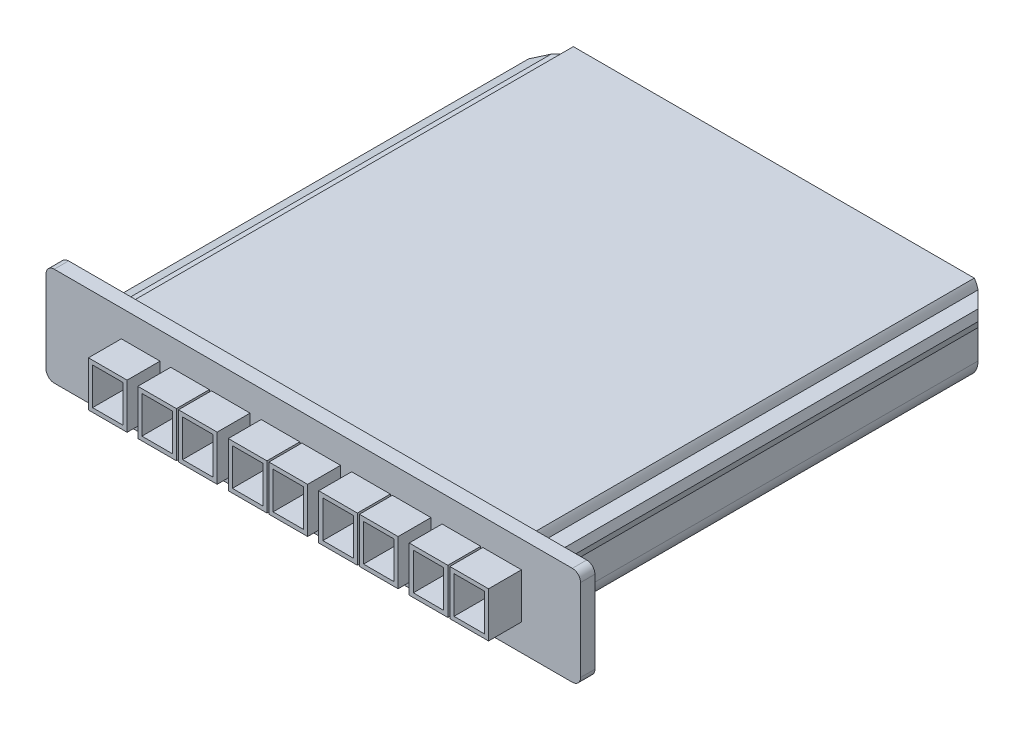
from build123d import *

# Parameters (mm, degrees)
EXTRUDE_1_DEPTH      = 12
EXTRUDE_1_DEPTH_BACK = 12
SKETCH_1_W           = 130
SKETCH_1_H           = 112
SKETCH_2_W           = 10.341275007
SKETCH_2_H           = 108.506204724
CUT_EXTRUDE_1_DEPTH  = 90.089842294
SKETCH_3_W           = 108.506204724
SKETCH_3_H           = 4.039795579
SKETCH_3_H_2         = 16.032937215
CUT_EXTRUDE_2_DEPTH  = 5
CHAMFER_1_SIZE       = 5
FILLET_1_R           = 5
CHAMFER_2_SIZE       = 2.747477419
CHAMFER_2_SIZE_2     = 1
FILLET_2_R           = 2
SKETCH_4_W           = 9.4
SKETCH_4_H           = 11
SKETCH_4_W_2         = 7.4
SKETCH_4_H_2         = 9
EXTRUDE_2_DEPTH      = 8
SKETCH_5_W           = 122.805441914
SKETCH_5_H           = 111.758877205
CUT_EXTRUDE_3_DEPTH  = 2


with BuildPart() as part:
    # 草图1 → 凸台-拉伸1 (new, two sides: drawn at the far end of the back side and taken through both)
    with BuildSketch(Plane(origin=(0, 0, 0), x_dir=(1, 0, 0), z_dir=(0, 1, 0)).offset(-EXTRUDE_1_DEPTH_BACK)):
        Rectangle(SKETCH_1_W, SKETCH_1_H)
    extrude(amount=EXTRUDE_1_DEPTH + EXTRUDE_1_DEPTH_BACK)

    # 草图2 → 切除-拉伸1 (cut, through all)
    with BuildSketch(Plane(origin=(0, 12, 0), x_dir=(1, 0, 0), z_dir=(0, 1, 0))):
        with Locations((59.829362496, 1.746897638)):
            Rectangle(SKETCH_2_W, SKETCH_2_H)
        with Locations((-59.829362496, 1.746897638)):
            Rectangle(SKETCH_2_W, SKETCH_2_H)
    extrude(amount=-CUT_EXTRUDE_1_DEPTH, mode=Mode.SUBTRACT)

    # 草图3 → 切除-拉伸2 (cut)
    with BuildSketch(Plane.ZY.offset(54.658724993)):
        with Locations((-1.746897638, 9.980102211)):
            Rectangle(SKETCH_3_W, SKETCH_3_H)
        with Locations((-1.746897638, -3.983531392)):
            Rectangle(SKETCH_3_W, SKETCH_3_H_2)
    cut_extrude_2 = extrude(amount=-CUT_EXTRUDE_2_DEPTH, mode=Mode.SUBTRACT)

    # 镜向1: 切除-拉伸2 across plane
    add(cut_extrude_2.mirror(Plane(origin=(0, 0, 0), x_dir=(0, 0, 1), z_dir=(1, 0, 0))), mode=Mode.SUBTRACT)

    # 倒角1
    chamfer_1_edges = [part.edges().sort_by_distance(p)[0] for p in [
        (-54.658724993, 5.996570818, -56),
        (54.658724993, 5.996570818, -56),
    ]]
    chamfer(chamfer_1_edges, length=CHAMFER_1_SIZE)

    # 圆角1
    # the kernel refuses this fillet: 5 mm, written as the material it takes off along each edge
    with BuildSketch(Plane(origin=(-49.658724993, 12, -68.267336577), x_dir=(0, -1, 0), z_dir=(0, 0, 1))) as fillet_1_piece_1:
        with BuildLine():
            CenterArc((5, 4.906934631), FILLET_1_R, 180, 78.928088112)
            Line((0, 4.906934631), (0, 0))
            Line((0, 0), (4.039795579, 0))
        make_face()
    extrude(amount=120.773541301, mode=Mode.SUBTRACT)
    with BuildSketch(Plane(origin=(-49.658724993, -12, -68.5), x_dir=(0, 1, 0), z_dir=(0, 0, 1)), Plane(origin=(49.658724993, -12, -68.5), x_dir=(-1, 0, 0), z_dir=(0, 0, 1))) as fillet_1_piece_2:
        with BuildLine():
            CenterArc((FILLET_1_R, -FILLET_1_R), FILLET_1_R, 90, 90)
            Line((0, -FILLET_1_R), (0, 0))
            Line((0, 0), (FILLET_1_R, 0))
        make_face()
    extrude(amount=121.006204724, mode=Mode.SUBTRACT)
    with BuildSketch(Plane(origin=(49.658724993, 12, -68.267336577), x_dir=(-1, 0, 0), z_dir=(0, 0, 1))) as fillet_1_piece_3:
        with BuildLine():
            CenterArc((4.906934631, 5), FILLET_1_R, 191.071911888, 78.928088112)
            Line((0, 4.039795579), (0, 0))
            Line((0, 0), (4.906934631, 0))
        make_face()
    extrude(amount=120.773541301, mode=Mode.SUBTRACT)

    # 倒角2
    # the kernel refuses this chamfer: 2.747477419, 1 mm, written as the material it takes off along each edge
    with BuildSketch(Plane(origin=(54.658724993, 7.960204421, 52.506204724), x_dir=(0.013184058198646324, -0.9999130865277316, 0), z_dir=(0, 0, -1))) as chamfer_2_piece_1:
        Polygon((CHAMFER_2_SIZE * 0.999913086693, CHAMFER_2_SIZE * 0.0131840582008), (-CHAMFER_2_SIZE_2 * 0.0131840581986, CHAMFER_2_SIZE_2 * 0.999913086528), (0, 0), align=None)
    extrude(amount=110.633696174, mode=Mode.SUBTRACT)
    with BuildSketch(Plane(origin=(54.658724993, 4.032937215, 52.506204724), x_dir=(-0.9950833631817486, -0.09904090225205064, 0), z_dir=(0, 0, -1))) as chamfer_2_piece_2:
        Polygon((CHAMFER_2_SIZE_2 * 0.995083363182, CHAMFER_2_SIZE_2 * 0.0990409022521), (-CHAMFER_2_SIZE * 0.0990409022684, CHAMFER_2_SIZE * 0.995083363346), (0, 0), align=None)
    extrude(amount=110.633696174, mode=Mode.SUBTRACT)
    with BuildSketch(Plane(origin=(-54.658724993, 4.032937215, 52.506204724), x_dir=(0.9999130865277316, -0.013184058198645857, 0), z_dir=(0, 0, -1))) as chamfer_2_piece_3:
        Polygon((CHAMFER_2_SIZE * 0.999913086693, -CHAMFER_2_SIZE * 0.0131840582008), (-CHAMFER_2_SIZE_2 * 0.0131840581986, -CHAMFER_2_SIZE_2 * 0.999913086528), (0, 0), align=None)
    extrude(amount=110.633696174, mode=Mode.SUBTRACT)
    with BuildSketch(Plane(origin=(-54.658724993, 7.960204421, 52.506204724), x_dir=(-0.09904090225204956, -0.9950833631817488, 0), z_dir=(0, 0, -1))) as chamfer_2_piece_4:
        Polygon((CHAMFER_2_SIZE_2 * 0.995083363182, -CHAMFER_2_SIZE_2 * 0.099040902252), (-CHAMFER_2_SIZE * 0.0990409022684, -CHAMFER_2_SIZE * 0.995083363346), (0, 0), align=None)
    extrude(amount=110.633696174, mode=Mode.SUBTRACT)

    # 圆角2
    fillet_2_edges = [part.edges().sort_by_distance(p)[0] for p in [
        (65, -12, 54.253102362),
        (65, 12, 54.253102362),
        (-65, 12, 54.253102362),
        (-65, -12, 54.253102362),
    ]]
    fillet(fillet_2_edges, radius=FILLET_2_R)

    # 草图4 → 凸台-拉伸2 (add)
    # profile 1 of 9: a face of its own
    with BuildSketch(Plane.XY.offset(56)):
        with Locations((-29.973556768, 0)):
            Rectangle(SKETCH_4_W, SKETCH_4_H)
        with Locations((-29.973556768, 0)):
            Rectangle(SKETCH_4_W_2, SKETCH_4_H_2, mode=Mode.SUBTRACT)
    # profile 2 of 9: a face of its own
    with BuildSketch(Plane.XY.offset(56)):
        with Locations((-41.973556768, 0)):
            Rectangle(SKETCH_4_W, SKETCH_4_H)
        with Locations((-41.973556768, 0)):
            Rectangle(SKETCH_4_W_2, SKETCH_4_H_2, mode=Mode.SUBTRACT)
    # profile 3 of 9: a face of its own
    with BuildSketch(Plane.XY.offset(56)):
        with Locations((-20.073556768, 0)):
            Rectangle(SKETCH_4_W, SKETCH_4_H)
        with Locations((-20.073556768, 0)):
            Rectangle(SKETCH_4_W_2, SKETCH_4_H_2, mode=Mode.SUBTRACT)
    # profile 4 of 9: a face of its own
    with BuildSketch(Plane.XY.offset(56)):
        with Locations((-7.973556768, 0)):
            Rectangle(SKETCH_4_W, SKETCH_4_H)
        with Locations((-7.973556768, 0)):
            Rectangle(SKETCH_4_W_2, SKETCH_4_H_2, mode=Mode.SUBTRACT)
    # profile 5 of 9: a face of its own
    with BuildSketch(Plane.XY.offset(56)):
        with Locations((1.926443232, 0)):
            Rectangle(SKETCH_4_W, SKETCH_4_H)
        with Locations((1.926443232, 0)):
            Rectangle(SKETCH_4_W_2, SKETCH_4_H_2, mode=Mode.SUBTRACT)
    # profile 6 of 9: a face of its own
    with BuildSketch(Plane.XY.offset(56)):
        with Locations((14.026443232, 0)):
            Rectangle(SKETCH_4_W, SKETCH_4_H)
        with Locations((14.026443232, 0)):
            Rectangle(SKETCH_4_W_2, SKETCH_4_H_2, mode=Mode.SUBTRACT)
    # profile 7 of 9: a face of its own
    with BuildSketch(Plane.XY.offset(56)):
        with Locations((23.926443232, 0)):
            Rectangle(SKETCH_4_W, SKETCH_4_H)
        with Locations((23.926443232, 0)):
            Rectangle(SKETCH_4_W_2, SKETCH_4_H_2, mode=Mode.SUBTRACT)
    # profile 8 of 9: a face of its own
    with BuildSketch(Plane.XY.offset(56)):
        with Locations((36.026443232, 0)):
            Rectangle(SKETCH_4_W, SKETCH_4_H)
        with Locations((36.026443232, 0)):
            Rectangle(SKETCH_4_W_2, SKETCH_4_H_2, mode=Mode.SUBTRACT)
    # profile 9 of 9: a face of its own
    with BuildSketch(Plane.XY.offset(56)):
        with Locations((45.926443232, 0)):
            Rectangle(SKETCH_4_W, SKETCH_4_H)
        with Locations((45.926443232, 0)):
            Rectangle(SKETCH_4_W_2, SKETCH_4_H_2, mode=Mode.SUBTRACT)
    extrude(amount=EXTRUDE_2_DEPTH)

    # 草图5 → 切除-拉伸3 (cut)
    with BuildSketch(Plane(origin=(0, 12, 0), x_dir=(1, 0, 0), z_dir=(0, 1, 0))):
        with Locations((1.597279043, 3.373233879)):
            Rectangle(SKETCH_5_W, SKETCH_5_H)
    cut_extrude_3 = extrude(amount=-CUT_EXTRUDE_3_DEPTH, mode=Mode.SUBTRACT)

    # 镜向2: 切除-拉伸3 across plane
    add(cut_extrude_3.mirror(Plane.ZX), mode=Mode.SUBTRACT)


solid = part.part
